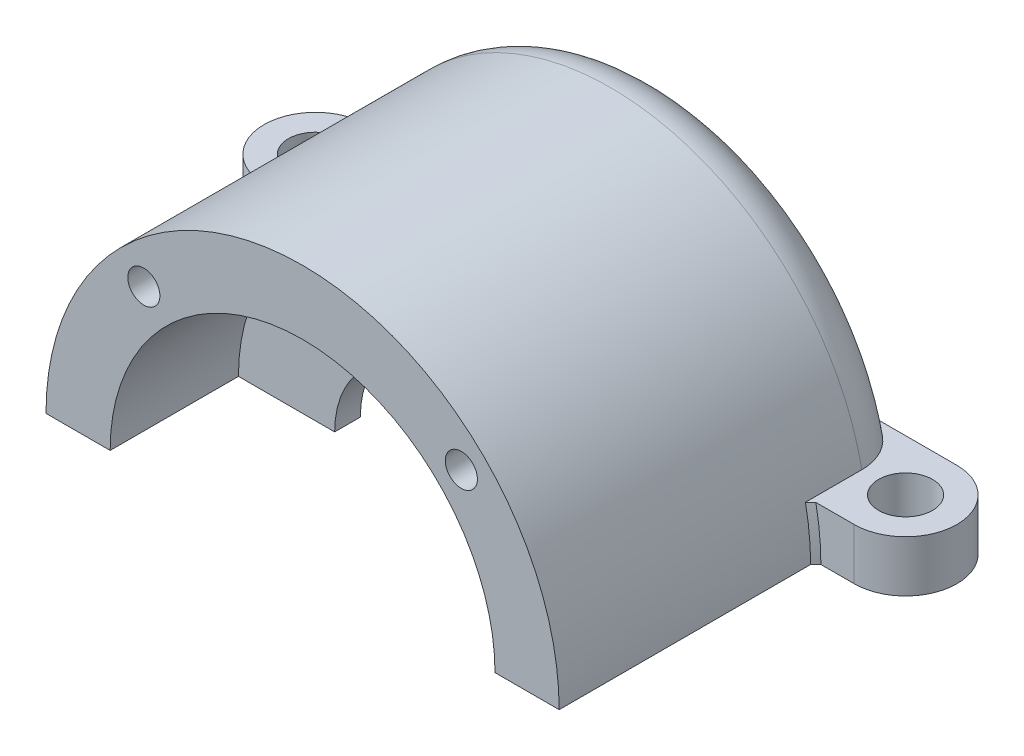
from build123d import *

# Parameters (mm, degrees)
REVOLVE_1_ANGLE          = 180
EXTRUDE_1_DEPTH          = 4
CUT_EXTRUDE_1_REACH      = 44.059
SKETCH_3_R               = 2.1
CUT_EXTRUDE_2_REACH      = 40.118
SKETCH_4_R               = 1.1
PATTERN_CIRCULAR_1_COUNT = 2
PATTERN_CIRCULAR_1_ANGLE = 60
PATTERN_CIRCULAR_2_COUNT = 2
PATTERN_CIRCULAR_2_ANGLE = 90
CHAMFER_1_SIZE           = 0.4
FILLET_1_R               = 4


with BuildPart() as part:
    # Эскиз1 → Повернуть1 (revolve)
    with BuildSketch(Plane(origin=(0, 0, 0), x_dir=(1, 0, 0), z_dir=(0, 1, 0))):
        Polygon((-15, 0), (-15, 10), (-7.5, 10), (-7.5, 12), (-11, 12), (-11, 28), (-20, 28), (-20, 0), align=None)
    revolve(axis=Axis((0, 0, 0), (0, 0, -1)), revolution_arc=REVOLVE_1_ANGLE)

    # Эскиз2 → Бобышка-Вытянуть1 (add)
    with BuildSketch(Plane(origin=(0, 0, 0), x_dir=(1, 0, 0), z_dir=(0, 1, 0))):
        with BuildLine():
            Line((11, 28), (23, 28))
            ThreePointArc((23, 28), (27, 24), (23, 20))
            Line((23, 20), (11, 20))
            Line((11, 20), (11, 28))
        make_face()
    extrude_1 = extrude(amount=EXTRUDE_1_DEPTH)

    # Эскиз3 → Вырез-Вытянуть1 (cut, up to next)
    with BuildSketch(Plane(origin=(0, 4, 0), x_dir=(1, 0, 0), z_dir=(0, 1, 0)), mode=Mode.PRIVATE) as cut_extrude_1_sk1:
        with Locations((23, 24)):
            Circle(SKETCH_3_R)
    cut_extrude_1_tool1 = extrude(cut_extrude_1_sk1.sketch, amount=-CUT_EXTRUDE_1_REACH, mode=Mode.PRIVATE) & part.part
    cut_extrude_1 = cut_extrude_1_tool1.solids().sort_by_distance((23, 4, -24))[0]
    add(cut_extrude_1, mode=Mode.SUBTRACT)

    # Зеркальное отражение1: Бобышка-Вытянуть1, Вырез-Вытянуть1 across plane
    add(extrude_1.mirror(Plane(origin=(0, 0, 0), x_dir=(0, 0, 1), z_dir=(1, 0, 0))))
    add(cut_extrude_1.mirror(Plane(origin=(0, 0, 0), x_dir=(0, 0, 1), z_dir=(1, 0, 0))), mode=Mode.SUBTRACT)

    # Эскиз4 → Вырез-Вытянуть2 (cut, up to next)
    with BuildSketch(Plane.XY.offset(-10), mode=Mode.PRIVATE) as cut_extrude_2_sk1:
        with Locations((4.75, 8.227241336)):
            Circle(SKETCH_4_R)
    cut_extrude_2_tool1 = extrude(cut_extrude_2_sk1.sketch, amount=-CUT_EXTRUDE_2_REACH, mode=Mode.PRIVATE) & part.part
    cut_extrude_2 = cut_extrude_2_tool1.solids().sort_by_distance((4.75, 8.227241, -10))[0]
    add(cut_extrude_2, mode=Mode.SUBTRACT)

    # Круговой массив1: Вырез-Вытянуть2 ×2 about axis
    pattern_circular_1_axis = Axis((0, 0, 0), (0, 0, 1))
    for i in range(1, PATTERN_CIRCULAR_1_COUNT):
        add(cut_extrude_2.rotate(pattern_circular_1_axis, i * PATTERN_CIRCULAR_1_ANGLE / (PATTERN_CIRCULAR_1_COUNT - 1)), mode=Mode.SUBTRACT)

    # Эскиз5 → Сверление под метчик M31 (revolve, cut)
    with BuildSketch(Plane(origin=(12.374368671, 12.374368671, 0), x_dir=(0, -1, 0), z_dir=(1, 0, 0))):
        Polygon((0, 0), (0, 15.751075774), (1.25, 15), (1.25, 0), align=None)
    hole_wizard_m31 = revolve(axis=Axis((12.374368671, 12.374368671, 6.35), (0, 0, -1)), mode=Mode.SUBTRACT)

    # Круговой массив2: Сверление под метчик M31 ×2 about axis
    pattern_circular_2_axis = Axis((0, 0, 0), (0, 0, 1))
    for i in range(1, PATTERN_CIRCULAR_2_COUNT):
        add(hole_wizard_m31.rotate(pattern_circular_2_axis, i * PATTERN_CIRCULAR_2_ANGLE / (PATTERN_CIRCULAR_2_COUNT - 1)), mode=Mode.SUBTRACT)

    # Фаска1
    chamfer_1_edges = [part.edges().sort_by_distance(p)[0] for p in [
        (-19.89872306, 2.01017924, -20),
        (19.89872306, 2.01017924, -20),
    ]]
    chamfer(chamfer_1_edges, length=CHAMFER_1_SIZE)

    # Скругление1
    fillet_1_edges = [part.edges().sort_by_distance(p)[0] for p in [
        (0, 20, -28),
    ]]
    fillet(fillet_1_edges, radius=FILLET_1_R)


solid = part.part
